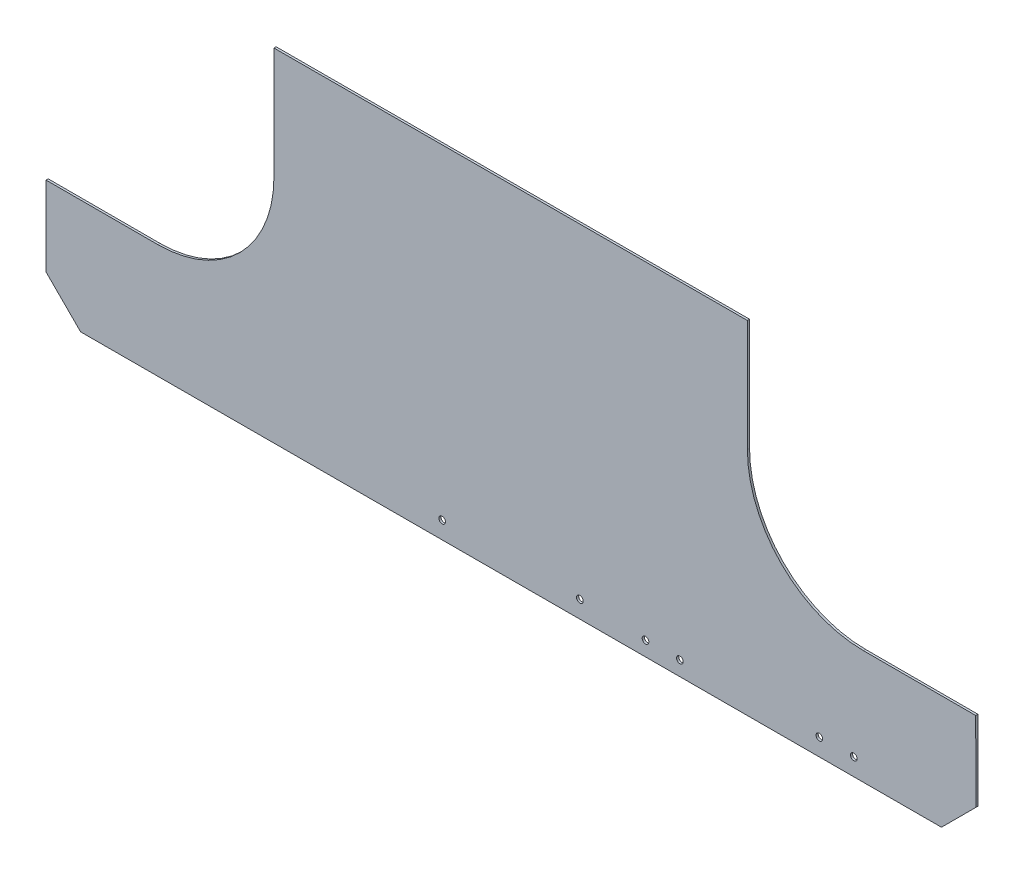
from build123d import *

# Parameters (mm, degrees)
SKETCH3_W                    = 914.4
SKETCH3_H                    = 609.6
BOSS_EXTRUDE1_DEPTH          = 0.79375
SKETCH4_OUTSIDE_W            = 1136.194
SKETCH4_OUTSIDE_H            = 831.394
CUT_EXTRUDE1_DEPTH           = 2.54
F_10_0_1935_DIAMETER_HOLE1_D = 4.9149
CUT_EXTRUDE5_DEPTH           = 2.54
CUT_EXTRUDE6_DEPTH           = 2.54


with BuildPart() as part:
    # Sketch3 → Boss-Extrude1 (new, symmetric)
    with BuildSketch(Plane.XY):
        Rectangle(SKETCH3_W, SKETCH3_H)
    extrude(amount=BOSS_EXTRUDE1_DEPTH, both=True)

    # Sketch4 outside → Cut-Extrude1 (cut)
    with BuildSketch(Plane.XY.offset(0.79375)):
        Rectangle(SKETCH4_OUTSIDE_W, SKETCH4_OUTSIDE_H)
        with BuildLine():
            Line((-362.506554298, 0.447439942), (318.21252852, 1.564886415))
            ThreePointArc((318.21252852, 1.564886415), (320.009798565, 0.823886977), (320.756694674, -0.970940586))
            Line((320.756694674, -0.970940586), (321.125317657, -225.526391983))
            Line((321.125317657, -225.526391983), (295.766909962, -250.884799679))
            Line((295.766909962, -250.884799679), (-339.232233443, -251.927193706))
            Line((-339.232233443, -251.927193706), (-364.674032102, -226.485395047))
            Line((-364.674032102, -226.485395047), (-365.0423813, -2.096726212))
            ThreePointArc((-365.0423813, -2.096726212), (-364.301381862, -0.299456167), (-362.506554298, 0.447439942))
        make_face(mode=Mode.SUBTRACT)
    extrude(amount=-CUT_EXTRUDE1_DEPTH, mode=Mode.SUBTRACT)

    # #10 (0.1935) Diameter Hole1 (through all)
    with Locations(Plane.XY.offset(0.79375)):
        with Locations((-314.391138724, -292.114748821), (-339.791138724, -292.114748821), (-365.546738216, -279.414748821), (295.564461784, -292.114748821), (270.164461784, -292.114748821), (321.320061276, -279.414748821), (174.915061771, -52.046344021), (-219.496738216, -52.046344021), (77.43654747, -240.486594059), (102.836513247, -240.444898294), (205.703184417, -238.332628273), (231.103150194, -238.290932508), (-72.553441175, -238.789405326), (29.046421932, -238.622622281)):
            Hole(F_10_0_1935_DIAMETER_HOLE1_D / 2)

    # Sketch13 → Cut-Extrude5 (cut)
    with BuildSketch(Plane(origin=(0, 0, -0.79375), x_dir=(-1, 0, 0), z_dir=(0, 0, -1))):
        with BuildLine():
            Line((-152.613233115, -81.22058342), (-152.613233115, 23.518073908))
            Line((-152.613233115, 23.518073908), (-342.941011359, 23.830509847))
            Line((-342.941011359, 23.830509847), (-343.254011981, -166.841258451))
            Line((-343.254011981, -166.841258451), (-238.233908146, -166.841258451))
            ThreePointArc((-238.233908146, -166.841258451), (-177.690948222, -141.763543344), (-152.613233115, -81.22058342))
        make_face()
    extrude(amount=-CUT_EXTRUDE5_DEPTH, mode=Mode.SUBTRACT)

    # Sketch12 → Cut-Extrude6 (cut)
    with BuildSketch(Plane(origin=(0, 0, -0.79375), x_dir=(-1, 0, 0), z_dir=(0, 0, -1))):
        with BuildLine():
            Line((196.636236426, 20.404753749), (384.763838571, 20.095930202))
            Line((384.763838571, 20.095930202), (384.455565363, -167.696021617))
            Line((384.455565363, -167.696021617), (282.223155875, -167.696021617))
            ThreePointArc((282.223155875, -167.696021617), (221.689410489, -142.471662195), (196.636236426, -81.866867765))
            Line((196.636236426, -81.866867765), (196.636236426, 20.404753749))
        make_face()
    extrude(amount=-CUT_EXTRUDE6_DEPTH, mode=Mode.SUBTRACT)


solid = part.part
